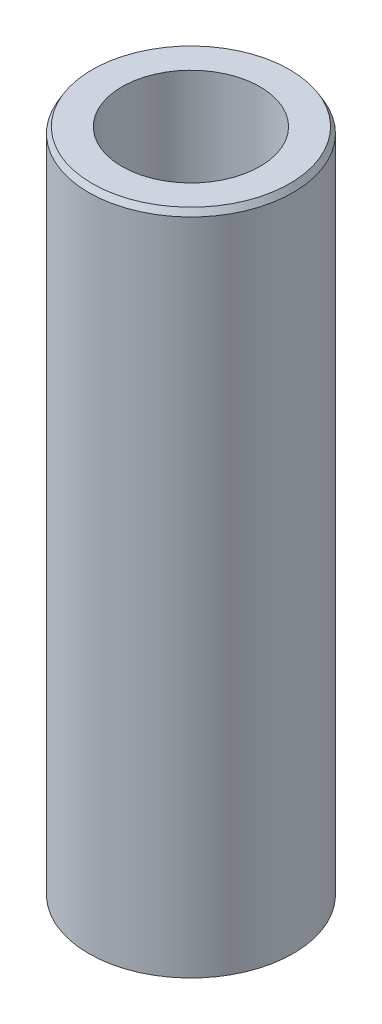
from build123d import *
from OCP.BRepFilletAPI import BRepFilletAPI_MakeChamfer

# Parameters (mm, degrees)
SKETCH1_R           = 60
BOSS_EXTRUDE1_DEPTH = 392.429999855
SKETCH2_R           = 40.534784065
CUT_EXTRUDE1_DEPTH  = 402.498822895
CHAMFER1_SIZE       = 3.535530027
CHAMFER1_SIZE2      = 2.041239213


with BuildPart() as part:
    # Sketch1 → Boss-Extrude1 (new body)
    with BuildSketch(Plane(origin=(0, 0, 0), x_dir=(1, 0, 0), z_dir=(0, 1, 0))):
        Circle(SKETCH1_R)
    extrude(amount=BOSS_EXTRUDE1_DEPTH)

    # Sketch2 → Cut-Extrude1 (cut, through all)
    with BuildSketch(Plane(origin=(0, 0, 0), x_dir=(1, 0, 0), z_dir=(0, 1, 0))):
        Circle(SKETCH2_R)
    extrude(amount=CUT_EXTRUDE1_DEPTH, mode=Mode.SUBTRACT)

    # Chamfer1: one chamfer whose edges measure the first distance from different faces: ONE call of the kernel's chamfer builder (chamfer() names one face for all edges)
    chamfer1_edges_1 = [part.edges().sort_by_distance(p)[0] for p in [
        (-60, 392.429999855, 0),
    ]]
    chamfer1_side_1 = [part.faces().sort_by_distance(p)[0] for p in [
        (-60, 196.214999927, 0),
    ]]
    chamfer1_edges_2 = [part.edges().sort_by_distance(p)[0] for p in [
        (-60, 0, 0),
    ]]
    chamfer1_side_2 = [part.faces().sort_by_distance(p)[0] for p in [
        (-58.302943725, 0, 0),
    ]]
    chamfer1 = BRepFilletAPI_MakeChamfer(part.part.solid().wrapped)
    for e in chamfer1_edges_1:
        chamfer1.Add(CHAMFER1_SIZE, CHAMFER1_SIZE2, e.wrapped, chamfer1_side_1[0].wrapped)  # the first distance lies on this face
    for e in chamfer1_edges_2:
        chamfer1.Add(CHAMFER1_SIZE, CHAMFER1_SIZE2, e.wrapped, chamfer1_side_2[0].wrapped)  # the first distance lies on this face
    add(Compound.cast(chamfer1.Shape()), mode=Mode.REPLACE)


solid = part.part
